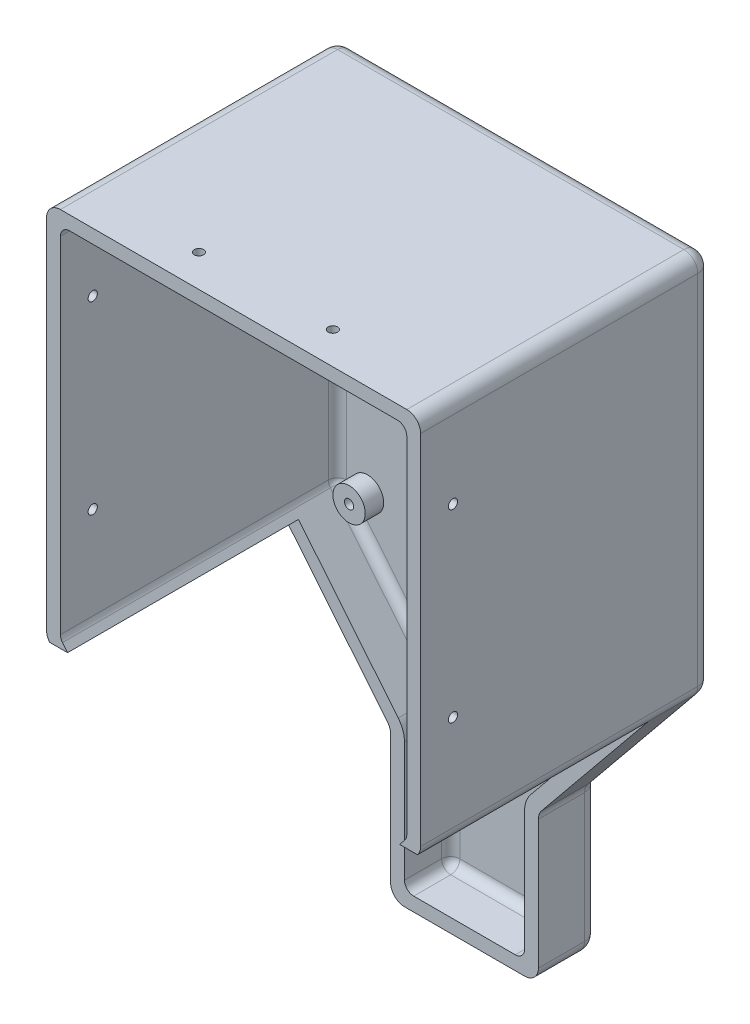
from build123d import *

# Parameters (mm, degrees)
SKETCH1_R                       = 3.5
SKETCH1_R_2                     = 1
PCB_STANDOFFS_DEPTH             = 4
PCB_STANDOFFS_2_DEPTH           = 4
PCB_STANDOFFS_3_DEPTH           = 4
PCB_STANDOFFS_4_DEPTH           = 4
CASE_BACKING_DEPTH              = 3
CASING_START                    = 60
CASING_SIDES_DEPTH              = 60
CASING_INNER_EDGE_FILLETS_2MM_R = 2
CASING_OUTER_EDGE_FILLETS_3MM_R = 3
BOTTOM_CASING_CUT_DEPTH         = 142.637742145
BOTTOM_CASING_CUT_DEPTH_BACK    = 142.637742145
SKETCH4_W                       = 50
SKETCH4_H                       = 61.171750673
SIDE_SCREWHOLES_DEPTH           = 142.637742145
SIDE_SCREWHOLES_DEPTH_BACK      = 142.637742145
SKETCH5_R                       = 1
TOP_SCREWHOLES_DEPTH            = 161.724920283
TOP_SCREWHOLES_DEPTH_BACK       = 161.724920283
SKETCH6_R                       = 1


with BuildPart() as part:
    # Sketch1 → PCB standoffs (new body)
    with BuildSketch(Plane.XY):
        with Locations((-31, 36)):
            Circle(SKETCH1_R)
        with Locations((-31, 36)):
            Circle(SKETCH1_R_2, mode=Mode.SUBTRACT)
    extrude(amount=PCB_STANDOFFS_DEPTH)



with BuildPart() as body_2:
    # Sketch1 → PCB standoffs 2 (new body)
    with BuildSketch(Plane.XY):
        with Locations((31, 36)):
            Circle(SKETCH1_R)
        with Locations((31, 36)):
            Circle(SKETCH1_R_2, mode=Mode.SUBTRACT)
    extrude(amount=PCB_STANDOFFS_2_DEPTH)


with BuildPart() as body_3:
    # Sketch1 → PCB standoffs 3 (new body)
    with BuildSketch(Plane.XY):
        with Locations((31, -36)):
            Circle(SKETCH1_R)
        with Locations((31, -36)):
            Circle(SKETCH1_R_2, mode=Mode.SUBTRACT)
    extrude(amount=PCB_STANDOFFS_3_DEPTH)


with BuildPart() as body_4:
    # Sketch1 → PCB standoffs 4 (new body)
    with BuildSketch(Plane.XY):
        with Locations((-31, -36)):
            Circle(SKETCH1_R)
        with Locations((-31, -36)):
            Circle(SKETCH1_R_2, mode=Mode.SUBTRACT)
    extrude(amount=PCB_STANDOFFS_4_DEPTH)


with BuildPart() as part_1:
    add(part.part)

    add(body_2.part)  # Case backing merges body 2

    add(body_3.part)  # Case backing merges body 3

    add(body_4.part)  # Case backing merges body 4
    # Sketch2 → Case backing (add)
    with BuildSketch(Plane(origin=(0, 0, 0), x_dir=(-1, 0, 0), z_dir=(0, 0, -1))):
        with BuildLine():
            Line((-40.5, -36.430645615), (-40.5, 41))
            ThreePointArc((-40.5, 41), (-39.621320344, 43.121320344), (-37.5, 44))
            Line((-37.5, 44), (37.5, 44))
            ThreePointArc((37.5, 44), (39.621320344, 43.121320344), (40.5, 41))
            Line((40.5, 41), (40.5, -36.430645615))
            ThreePointArc((40.5, -36.430645615), (40.325844046, -37.437921856), (39.823596383, -38.328249327))
            Line((39.823596383, -38.328249327), (16.676403617, -66.671750673))
            ThreePointArc((16.676403617, -66.671750673), (16.174155954, -67.562078144), (16, -68.569354385))
            Line((16, -68.569354385), (16, -96.5))
            ThreePointArc((16, -96.5), (15.121320344, -98.621320344), (13, -99.5))
            Line((13, -99.5), (-13, -99.5))
            ThreePointArc((-13, -99.5), (-15.121320344, -98.621320344), (-16, -96.5))
            Line((-16, -96.5), (-16, -68.569354385))
            ThreePointArc((-16, -68.569354385), (-16.174155954, -67.562078144), (-16.676403617, -66.671750673))
            Line((-16.676403617, -66.671750673), (-39.823596383, -38.328249327))
            ThreePointArc((-39.823596383, -38.328249327), (-40.325844046, -37.437921856), (-40.5, -36.430645615))
        make_face()
    extrude(amount=CASE_BACKING_DEPTH)

    # Sketch3 → Casing sides (add)
    with BuildSketch(Plane.XY.offset(CASING_START)):
        with BuildLine():
            Line((16, -96.5), (16, -68.569354385))
            ThreePointArc((16, -68.569354385), (16.174155954, -67.562078144), (16.676403617, -66.671750673))
            Line((16.676403617, -66.671750673), (39.823596383, -38.328249327))
            ThreePointArc((39.823596383, -38.328249327), (40.325844046, -37.437921856), (40.5, -36.430645615))
            Line((40.5, -36.430645615), (40.5, 41))
            ThreePointArc((40.5, 41), (39.621320344, 43.121320344), (37.5, 44))
            Line((37.5, 44), (-37.5, 44))
            ThreePointArc((-37.5, 44), (-39.621320344, 43.121320344), (-40.5, 41))
            Line((-40.5, 41), (-40.5, -36.430645615))
            ThreePointArc((-40.5, -36.430645615), (-40.325844046, -37.437921856), (-39.823596383, -38.328249327))
            Line((-39.823596383, -38.328249327), (-16.676403617, -66.671750673))
            ThreePointArc((-16.676403617, -66.671750673), (-16.174155954, -67.562078144), (-16, -68.569354385))
            Line((-16, -68.569354385), (-16, -96.5))
            ThreePointArc((-16, -96.5), (-15.121320344, -98.621320344), (-13, -99.5))
            Line((-13, -99.5), (13, -99.5))
            ThreePointArc((13, -99.5), (15.121320344, -98.621320344), (16, -96.5))
        make_face()
        with BuildLine():
            Line((13, -96.5), (13, -68.569354385))
            ThreePointArc((13, -68.569354385), (13.348311907, -66.554801903), (14.352807234, -64.77414696))
            Line((14.352807234, -64.77414696), (37.5, -36.430645615))
            Line((37.5, -36.430645615), (37.5, 41))
            Line((37.5, 41), (-37.5, 41))
            Line((-37.5, 41), (-37.5, -36.430645615))
            Line((-37.5, -36.430645615), (-14.352807234, -64.77414696))
            ThreePointArc((-14.352807234, -64.77414696), (-13.348311907, -66.554801903), (-13, -68.569354385))
            Line((-13, -68.569354385), (-13, -96.5))
            Line((-13, -96.5), (13, -96.5))
        make_face(mode=Mode.SUBTRACT)
    extrude(amount=-CASING_SIDES_DEPTH)

    # Casing inner edge fillets 2mm
    # the kernel refuses this fillet: 2 mm, written as the material it adds along each edge
    with BuildSketch(Plane(origin=(11, -94.5, 2), x_dir=(0, -1, 0), z_dir=(0, 0, -1))) as casing_inner_edge_fillets_2mm_piece_1_section:
        Polygon((0, 0), (CASING_INNER_EDGE_FILLETS_2MM_R, 0), (CASING_INNER_EDGE_FILLETS_2MM_R, -CASING_INNER_EDGE_FILLETS_2MM_R), (0, -CASING_INNER_EDGE_FILLETS_2MM_R), align=None)
    casing_inner_edge_fillets_2mm_piece_1 = extrude(amount=CASING_INNER_EDGE_FILLETS_2MM_R, mode=Mode.PRIVATE)
    casing_inner_edge_fillets_2mm_piece_1 = casing_inner_edge_fillets_2mm_piece_1 - Plane(origin=(11, -94.5, 2), x_dir=(-0.7071067811865475, 0.7071067811865475, 0), z_dir=(0, 0, -1)) * Sphere(CASING_INNER_EDGE_FILLETS_2MM_R, mode=Mode.PRIVATE)
    add(casing_inner_edge_fillets_2mm_piece_1)
    with BuildSketch(Plane(origin=(35.5, -35.717742691, 2), x_dir=(0.7745321275866414, -0.6325345708624239, 0), z_dir=(0, 0, -1))) as casing_inner_edge_fillets_2mm_piece_2_section:
        Polygon((0, 0), (CASING_INNER_EDGE_FILLETS_2MM_R, 0), (CASING_INNER_EDGE_FILLETS_2MM_R, -CASING_INNER_EDGE_FILLETS_2MM_R * 0.356451461785), (CASING_INNER_EDGE_FILLETS_2MM_R * 0.774532127587, -CASING_INNER_EDGE_FILLETS_2MM_R * 0.632534570862), align=None)
    casing_inner_edge_fillets_2mm_piece_2 = extrude(amount=CASING_INNER_EDGE_FILLETS_2MM_R, mode=Mode.PRIVATE)
    casing_inner_edge_fillets_2mm_piece_2 = casing_inner_edge_fillets_2mm_piece_2 - Plane(origin=(35.5, -35.717742691, 2), x_dir=(-0.9419480154410438, 0.3357587470292908, 0), z_dir=(0, 0, -1)) * Sphere(CASING_INNER_EDGE_FILLETS_2MM_R, mode=Mode.PRIVATE)
    add(casing_inner_edge_fillets_2mm_piece_2)
    with BuildSketch(Plane(origin=(35.5, 39, 2), x_dir=(1, 0, 0), z_dir=(0, 0, -1))) as casing_inner_edge_fillets_2mm_piece_3_section:
        Polygon((0, 0), (CASING_INNER_EDGE_FILLETS_2MM_R, 0), (CASING_INNER_EDGE_FILLETS_2MM_R, -CASING_INNER_EDGE_FILLETS_2MM_R), (0, -CASING_INNER_EDGE_FILLETS_2MM_R), align=None)
    casing_inner_edge_fillets_2mm_piece_3 = extrude(amount=CASING_INNER_EDGE_FILLETS_2MM_R, mode=Mode.PRIVATE)
    casing_inner_edge_fillets_2mm_piece_3 = casing_inner_edge_fillets_2mm_piece_3 - Plane(origin=(35.5, 39, 2), x_dir=(-0.7071067811865475, -0.7071067811865476, 0), z_dir=(0, 0, -1)) * Sphere(CASING_INNER_EDGE_FILLETS_2MM_R, mode=Mode.PRIVATE)
    add(casing_inner_edge_fillets_2mm_piece_3)
    with BuildSketch(Plane(origin=(-35.5, 39, 2), x_dir=(0, 0, -1), z_dir=(-1, 0, 0))) as casing_inner_edge_fillets_2mm_piece_4_section:
        Polygon((0, 0), (CASING_INNER_EDGE_FILLETS_2MM_R, 0), (CASING_INNER_EDGE_FILLETS_2MM_R, -CASING_INNER_EDGE_FILLETS_2MM_R), (0, -CASING_INNER_EDGE_FILLETS_2MM_R), align=None)
    casing_inner_edge_fillets_2mm_piece_4 = extrude(amount=CASING_INNER_EDGE_FILLETS_2MM_R, mode=Mode.PRIVATE)
    casing_inner_edge_fillets_2mm_piece_4 = casing_inner_edge_fillets_2mm_piece_4 - Plane(origin=(-35.5, 39, 2), x_dir=(0, -0.7071067811865475, 0.7071067811865475), z_dir=(-1, 0, 0)) * Sphere(CASING_INNER_EDGE_FILLETS_2MM_R, mode=Mode.PRIVATE)
    add(casing_inner_edge_fillets_2mm_piece_4)
    with BuildSketch(Plane(origin=(-35.5, -35.717742691, 2), x_dir=(-0.7745321275866417, -0.6325345708624235, 0), z_dir=(0, 0, -1))) as casing_inner_edge_fillets_2mm_piece_5_section:
        Polygon((0, 0), (CASING_INNER_EDGE_FILLETS_2MM_R, 0), (CASING_INNER_EDGE_FILLETS_2MM_R, CASING_INNER_EDGE_FILLETS_2MM_R * 0.356451461785), (CASING_INNER_EDGE_FILLETS_2MM_R * 0.774532127587, CASING_INNER_EDGE_FILLETS_2MM_R * 0.632534570862), align=None)
    casing_inner_edge_fillets_2mm_piece_5 = extrude(amount=CASING_INNER_EDGE_FILLETS_2MM_R, mode=Mode.PRIVATE)
    casing_inner_edge_fillets_2mm_piece_5 = casing_inner_edge_fillets_2mm_piece_5 - Plane(origin=(-35.5, -35.717742691, 2), x_dir=(0.9419480154410438, 0.3357587470292907, 0), z_dir=(0, 0, -1)) * Sphere(CASING_INNER_EDGE_FILLETS_2MM_R, mode=Mode.PRIVATE)
    add(casing_inner_edge_fillets_2mm_piece_5)
    with BuildSketch(Plane(origin=(-11, -94.5, 2), x_dir=(0, 0, -1), z_dir=(-1, 0, 0))) as casing_inner_edge_fillets_2mm_piece_6_section:
        Polygon((0, 0), (CASING_INNER_EDGE_FILLETS_2MM_R, 0), (CASING_INNER_EDGE_FILLETS_2MM_R, CASING_INNER_EDGE_FILLETS_2MM_R), (0, CASING_INNER_EDGE_FILLETS_2MM_R), align=None)
    casing_inner_edge_fillets_2mm_piece_6 = extrude(amount=CASING_INNER_EDGE_FILLETS_2MM_R, mode=Mode.PRIVATE)
    casing_inner_edge_fillets_2mm_piece_6 = casing_inner_edge_fillets_2mm_piece_6 - Plane(origin=(-11, -94.5, 2), x_dir=(0, 0.7071067811865475, 0.7071067811865475), z_dir=(-1, 0, 0)) * Sphere(CASING_INNER_EDGE_FILLETS_2MM_R, mode=Mode.PRIVATE)
    add(casing_inner_edge_fillets_2mm_piece_6)
    with BuildSketch(Plane(origin=(13, -94.5, 0), x_dir=(-1, 0, 0), z_dir=(0, 1, 0))) as casing_inner_edge_fillets_2mm_piece_7:
        with BuildLine():
            CenterArc((CASING_INNER_EDGE_FILLETS_2MM_R, CASING_INNER_EDGE_FILLETS_2MM_R), CASING_INNER_EDGE_FILLETS_2MM_R, 180, 90)
            Line((0, CASING_INNER_EDGE_FILLETS_2MM_R), (0, 0))
            Line((0, 0), (CASING_INNER_EDGE_FILLETS_2MM_R, 0))
        make_face()
    extrude(amount=25.930645615)
    with BuildSketch(Plane(origin=(19, -68.569354385, 0), x_dir=(-1, 0, 0), z_dir=(0, -1, 0))) as casing_inner_edge_fillets_2mm_piece_8:
        with BuildLine():
            CenterArc((6 + CASING_INNER_EDGE_FILLETS_2MM_R, -CASING_INNER_EDGE_FILLETS_2MM_R), CASING_INNER_EDGE_FILLETS_2MM_R, 90, 90)
            Line((6, -CASING_INNER_EDGE_FILLETS_2MM_R), (6, 0))
            Line((6, 0), (6 + CASING_INNER_EDGE_FILLETS_2MM_R, 0))
        make_face()
    revolve(axis=Axis((19, -68.569354385, 0), (0, 0, -1)), revolution_arc=39.237367113)
    with BuildSketch(Plane(origin=(14.352807234, -64.77414696, 0), x_dir=(-0.7745321275866413, 0.6325345708624239, 0), z_dir=(0.6325345708624239, 0.7745321275866414, 0)), Plane(origin=(-37.049064255, -36.982811833, 0), x_dir=(0.7745321275866417, 0.6325345708624235, 0), z_dir=(0.6325345708624235, -0.7745321275866417, 0))) as casing_inner_edge_fillets_2mm_piece_9:
        with BuildLine():
            CenterArc((CASING_INNER_EDGE_FILLETS_2MM_R, CASING_INNER_EDGE_FILLETS_2MM_R), CASING_INNER_EDGE_FILLETS_2MM_R, 180, 90)
            Line((0, CASING_INNER_EDGE_FILLETS_2MM_R), (0, 0))
            Line((0, 0), (CASING_INNER_EDGE_FILLETS_2MM_R, 0))
        make_face()
    extrude(amount=35.881449119)
    with BuildSketch(Plane(origin=(37.5, -35.717742691, 0), x_dir=(-1, 0, 0), z_dir=(0, 1, 0)), Plane(origin=(-37.5, 39, 0), x_dir=(1, 0, 0), z_dir=(0, -1, 0))) as casing_inner_edge_fillets_2mm_piece_10:
        with BuildLine():
            CenterArc((CASING_INNER_EDGE_FILLETS_2MM_R, CASING_INNER_EDGE_FILLETS_2MM_R), CASING_INNER_EDGE_FILLETS_2MM_R, 180, 90)
            Line((0, CASING_INNER_EDGE_FILLETS_2MM_R), (0, 0))
            Line((0, 0), (CASING_INNER_EDGE_FILLETS_2MM_R, 0))
        make_face()
    extrude(amount=74.717742691)
    with BuildSketch(Plane(origin=(35.5, 41, 0), x_dir=(0, -1, 0), z_dir=(-1, 0, 0))) as casing_inner_edge_fillets_2mm_piece_11:
        with BuildLine():
            CenterArc((CASING_INNER_EDGE_FILLETS_2MM_R, CASING_INNER_EDGE_FILLETS_2MM_R), CASING_INNER_EDGE_FILLETS_2MM_R, 180, 90)
            Line((0, CASING_INNER_EDGE_FILLETS_2MM_R), (0, 0))
            Line((0, 0), (CASING_INNER_EDGE_FILLETS_2MM_R, 0))
        make_face()
    extrude(amount=71)
    with BuildSketch(Plane(origin=(-19, -68.569354385, 0), x_dir=(0.7745321275866426, 0.6325345708624223, 0), z_dir=(-0.6325345708624223, 0.7745321275866426, 0))) as casing_inner_edge_fillets_2mm_piece_12:
        with BuildLine():
            CenterArc((6 + CASING_INNER_EDGE_FILLETS_2MM_R, -CASING_INNER_EDGE_FILLETS_2MM_R), CASING_INNER_EDGE_FILLETS_2MM_R, 90, 90)
            Line((6, -CASING_INNER_EDGE_FILLETS_2MM_R), (6, 0))
            Line((6, 0), (6 + CASING_INNER_EDGE_FILLETS_2MM_R, 0))
        make_face()
    revolve(axis=Axis((-19, -68.569354385, 0), (0, 0, -1)), revolution_arc=39.237367113)
    with BuildSketch(Plane(origin=(-13, -68.569354385, 0), x_dir=(0, 0, 1), z_dir=(0, -1, 0))) as casing_inner_edge_fillets_2mm_piece_13:
        with BuildLine():
            CenterArc((CASING_INNER_EDGE_FILLETS_2MM_R, -CASING_INNER_EDGE_FILLETS_2MM_R), CASING_INNER_EDGE_FILLETS_2MM_R, 90, 90)
            Line((0, -CASING_INNER_EDGE_FILLETS_2MM_R), (0, 0))
            Line((0, 0), (CASING_INNER_EDGE_FILLETS_2MM_R, 0))
        make_face()
    extrude(amount=25.930645615)
    with BuildSketch(Plane(origin=(-11, -96.5, 0), x_dir=(0, 1, 0), z_dir=(1, 0, 0))) as casing_inner_edge_fillets_2mm_piece_14:
        with BuildLine():
            CenterArc((CASING_INNER_EDGE_FILLETS_2MM_R, CASING_INNER_EDGE_FILLETS_2MM_R), CASING_INNER_EDGE_FILLETS_2MM_R, 180, 90)
            Line((0, CASING_INNER_EDGE_FILLETS_2MM_R), (0, 0))
            Line((0, 0), (CASING_INNER_EDGE_FILLETS_2MM_R, 0))
        make_face()
    extrude(amount=22)
    with BuildSketch(Plane(origin=(37.5, -36.430645615, 60), x_dir=(-0.6325345708624265, -0.7745321275866391, 0), z_dir=(0, 0, -1)), Plane(origin=(-37.5, -36.430645615, 60), x_dir=(0, 1, 0), z_dir=(0, 0, -1))) as casing_inner_edge_fillets_2mm_piece_15:
        with BuildLine():
            CenterArc((CASING_INNER_EDGE_FILLETS_2MM_R * 0.356451461785, CASING_INNER_EDGE_FILLETS_2MM_R), CASING_INNER_EDGE_FILLETS_2MM_R, 230.762632887, 39.237367113)
            Line((-CASING_INNER_EDGE_FILLETS_2MM_R * 0.276083109078, CASING_INNER_EDGE_FILLETS_2MM_R * 0.225467872413), (0, 0))
            Line((0, 0), (CASING_INNER_EDGE_FILLETS_2MM_R * 0.356451461785, 0))
        make_face()
    extrude(amount=58)
    with BuildSketch(Plane(origin=(37.5, 41, 60), x_dir=(0, -1, 0), z_dir=(0, 0, -1)), Plane(origin=(-37.5, 41, 60), x_dir=(1, 0, 0), z_dir=(0, 0, -1)), Plane(origin=(-13, -96.5, 60), x_dir=(0, 1, 0), z_dir=(0, 0, -1)), Plane(origin=(13, -96.5, 60), x_dir=(-1, 0, 0), z_dir=(0, 0, -1))) as casing_inner_edge_fillets_2mm_piece_16:
        with BuildLine():
            CenterArc((CASING_INNER_EDGE_FILLETS_2MM_R, CASING_INNER_EDGE_FILLETS_2MM_R), CASING_INNER_EDGE_FILLETS_2MM_R, 180, 90)
            Line((0, CASING_INNER_EDGE_FILLETS_2MM_R), (0, 0))
            Line((0, 0), (CASING_INNER_EDGE_FILLETS_2MM_R, 0))
        make_face()
    extrude(amount=58)

    # Casing outer edge fillets 3mm
    casing_outer_edge_fillets_3mm_edges = [part_1.edges().sort_by_distance(p)[0] for p in [
        (15.121320344, -98.621320344, -3),
        (0, -99.5, -3),
        (-15.121320344, -98.621320344, -3),
        (-16, -82.534677193, -3),
        (-16.174155954, -67.562078144, -3),
        (-28.25, -52.5, -3),
        (-40.325844046, -37.437921856, -3),
        (-40.5, 2.284677193, -3),
        (-39.621320344, 43.121320344, -3),
        (0, 44, -3),
        (39.621320344, 43.121320344, -3),
        (40.5, 2.284677193, -3),
        (40.325844046, -37.437921856, -3),
        (28.25, -52.5, -3),
        (16.174155954, -67.562078144, -3),
        (16, -82.534677193, -3),
    ]]
    fillet(casing_outer_edge_fillets_3mm_edges, radius=CASING_OUTER_EDGE_FILLETS_3MM_R)

    # Sketch4 → Bottom casing cut (cut, two sides: drawn at the far end of the back side and taken through both)
    with BuildSketch(Plane.ZY.offset(40.5).offset(-BOTTOM_CASING_CUT_DEPTH_BACK)):
        with Locations((35, -68.914124664)):
            Rectangle(SKETCH4_W, SKETCH4_H)
    extrude(amount=BOTTOM_CASING_CUT_DEPTH + BOTTOM_CASING_CUT_DEPTH_BACK, mode=Mode.SUBTRACT)

    # Sketch5 → Side screwholes (cut, two sides: drawn at the far end of the back side and taken through both)
    with BuildSketch(Plane(origin=(40.5, 0, 0), x_dir=(0, 0, -1), z_dir=(1, 0, 0)).offset(-SIDE_SCREWHOLES_DEPTH_BACK)):
        with Locations(Location((-53, 24.282257309, 0), (0, 0, 270))):
            Circle(SKETCH5_R)
        with Locations(Location((-53, -15.717742691, 0), (0, 0, 270))):
            Circle(SKETCH5_R)
    extrude(amount=SIDE_SCREWHOLES_DEPTH + SIDE_SCREWHOLES_DEPTH_BACK, mode=Mode.SUBTRACT)

    # Sketch6 → Top screwholes (cut, two sides: drawn at the far end of the back side and taken through both)
    with BuildSketch(Plane(origin=(0, 44, 0), x_dir=(1, 0, 0), z_dir=(0, 1, 0)).offset(-TOP_SCREWHOLES_DEPTH_BACK)):
        with Locations((14.5, -53)):
            Circle(SKETCH6_R)
        with Locations((-14.5, -53)):
            Circle(SKETCH6_R)
    extrude(amount=TOP_SCREWHOLES_DEPTH + TOP_SCREWHOLES_DEPTH_BACK, mode=Mode.SUBTRACT)


solid = part_1.part
